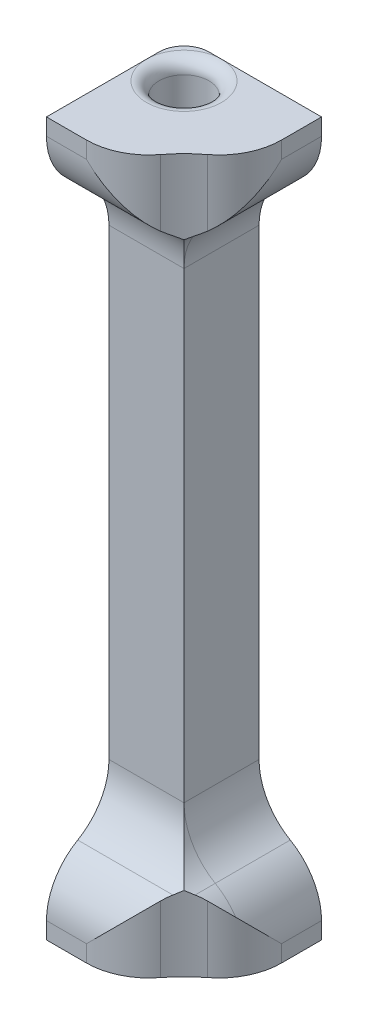
from build123d import *

# Parameters (mm, degrees)
BOSS_EXTRUDE1_DEPTH = 28.5
SKETCH3_R           = 2
CUT_EXTRUDE1_DEPTH  = 29.81405906844782
SKETCH4_W           = 5.000000000000001
SKETCH4_H           = 6
SKETCH4_W_2         = 6
SKETCH4_H_2         = 5
BOSS_EXTRUDE2_DEPTH = 5
FILLET1_R           = 10
FILLET3_R           = 5
FILLET4_R           = 5
FILLET5_R           = 2
CUT_EXTRUDE2_START  = -4
SKETCH5_R           = 2.5
CUT_EXTRUDE2_DEPTH  = 4
CUT_EXTRUDE3_START  = -8
SKETCH6_R           = 2.5
CUT_EXTRUDE3_DEPTH  = 4
FILLET6_R           = 1


# Some blends are built 0.0001 mm under size
with BuildPart() as part:
    # Sketch2 → Boss-Extrude1 (new body)
    with BuildSketch(Plane(origin=(0, 0, 0), x_dir=(1, 0, 0), z_dir=(0, 1, 0))):
        Polygon((-3.000000000000001, 3), (2.999999999999999, 3), (3, -3), (-3, -3), align=None)
    extrude(amount=BOSS_EXTRUDE1_DEPTH)

    # Sketch3 → Cut-Extrude1 (cut, through all)
    with BuildSketch(Plane.XZ):
        with Locations(Location((0, 0, 0), (0, 0, 270))):
            Circle(SKETCH3_R)
    extrude(amount=-CUT_EXTRUDE1_DEPTH, mode=Mode.SUBTRACT)

    # Sketch4 → Boss-Extrude2 (add)
    with BuildSketch(Plane.XZ):
        with Locations((5.5, 0)):
            Rectangle(SKETCH4_W, SKETCH4_H)
        with Locations((0, 5.5)):
            Rectangle(SKETCH4_W_2, SKETCH4_H_2)
    extrude(amount=-BOSS_EXTRUDE2_DEPTH)

    # Fillet1
    # the kernel refuses this fillet: 10 mm, written as the material it adds along each edge
    with BuildSketch(Plane(origin=(3, 0, 3), x_dir=(3.6e-16, 0, 1), z_dir=(0, 1, 0))) as fillet1_piece_1:
        with BuildLine():
            CenterArc((9.11437827766148, 9.114378277661475), FILLET1_R, 204.29518894536457, 41.4096221092708)
            Line((1.78e-15, 5), (0, 0))
            Line((0, 0), (5, 0))
        make_face()
    extrude(amount=5)

    # Fillet3
    # the kernel refuses this fillet: 5 mm, written as the material it adds along each edge
    with BuildSketch(Plane(origin=(3, 5, 3), x_dir=(0, 0, 1), z_dir=(-1, 0, 0))) as fillet3_piece_1:
        with BuildLine():
            CenterArc((FILLET3_R, FILLET3_R), FILLET3_R, 180, 90)
            Line((-8.9e-16, FILLET3_R), (0, 0))
            Line((0, 0), (FILLET3_R, 0))
        make_face()
    extrude(amount=6)
    with BuildSketch(Plane(origin=(2.999999999999999, 5, 3), x_dir=(1, 0, 0), z_dir=(0, 0, -1))) as fillet3_piece_2:
        with BuildLine():
            CenterArc((FILLET3_R, -FILLET3_R), FILLET3_R, 90, 90)
            Line((-8.9e-16, -FILLET3_R), (0, 0))
            Line((0, 0), (FILLET3_R, 0))
        make_face()
    extrude(amount=6)
    with BuildSketch(Plane(origin=(15.5, 5, 3), x_dir=(0, 0, 1), z_dir=(-1, 0, 0))) as fillet3_piece_3a_section:
        with BuildLine():
            CenterArc((FILLET3_R, FILLET3_R), FILLET3_R, 180, 90)
            Line((-8.9e-16, FILLET3_R), (0, 0))
            Line((0, 0), (FILLET3_R, 0))
        make_face()
    fillet3_piece_3a = extrude(amount=18.5, mode=Mode.PRIVATE)
    fillet3_piece_3a = fillet3_piece_3a - Plane(origin=(12.114378277661, 5, 12.114378277661), x_dir=(0, 0, 1), z_dir=(0, -1, 0)) * Cylinder(10, 57, mode=Mode.PRIVATE)
    fillet3_piece_3a = split(fillet3_piece_3a, bisect_by=Plane(origin=(8, 5, 3), z_dir=(-1, 0, 0)), keep=Keep.TOP, mode=Mode.PRIVATE)
    fillet3_piece_3a = split(fillet3_piece_3a, bisect_by=Plane(origin=(3, 5, 3.0000000000000018), z_dir=(1, 0, -1.5e-16)), keep=Keep.TOP, mode=Mode.PRIVATE)
    with BuildSketch(Plane(origin=(2.999999999999999, 5, 15.5), x_dir=(1, 0, 0), z_dir=(0, 0, -1))) as fillet3_piece_3b_section:
        with BuildLine():
            CenterArc((FILLET3_R, -FILLET3_R), FILLET3_R, 90, 90)
            Line((-8.9e-16, -FILLET3_R), (0, 0))
            Line((0, 0), (FILLET3_R, 0))
        make_face()
    fillet3_piece_3b = extrude(amount=18.5, mode=Mode.PRIVATE)
    fillet3_piece_3b = fillet3_piece_3b - Plane(origin=(12.114378277661, 5, 12.114378277661), x_dir=(0, 0, 1), z_dir=(0, -1, 0)) * Cylinder(10, 57, mode=Mode.PRIVATE)
    fillet3_piece_3b = split(fillet3_piece_3b, bisect_by=Plane(origin=(2.999999999999999, 5, 8), z_dir=(0, 0, -1)), keep=Keep.TOP, mode=Mode.PRIVATE)
    fillet3_piece_3b = split(fillet3_piece_3b, bisect_by=Plane(origin=(2.999999999999999, 5, 3), z_dir=(0, 0, 1)), keep=Keep.TOP, mode=Mode.PRIVATE)
    fillet3_piece_3 = fillet3_piece_3a & fillet3_piece_3b
    add(fillet3_piece_3)

    # Fillet4
    fillet4_edges = [part.edges().sort_by_distance(p)[0] for p in [
        (8, 2.5, 3),
        (8, 5, 0),
        (3, 2.5, 8),
        (0, 5, 8),
    ]]
    fillet(fillet4_edges, radius=FILLET4_R)

    # Mirror1: part across plane


with BuildPart() as part_1:
    add(part.part)
    add(part.part.mirror(Plane.ZX.offset(28.5)))

    # Fillet5
    fillet5_edges = [part_1.edges().sort_by_distance(p)[0] for p in [
        (-3.000000000000001, 28.5, -3),
    ]]
    fillet(fillet5_edges, radius=FILLET5_R)

    # Sketch5 → Cut-Extrude2 (cut)
    with BuildSketch(Plane.XZ.offset(CUT_EXTRUDE2_START)):
        with Locations(Location((0, 0, 0), (0, 0, 270))):
            Circle(SKETCH5_R)
    extrude(amount=-CUT_EXTRUDE2_DEPTH, mode=Mode.SUBTRACT)

    # Sketch6 → Cut-Extrude3 (cut)
    with BuildSketch(Plane(origin=(0, 57, 0), x_dir=(1, 0, 0), z_dir=(0, 1, 0)).offset(CUT_EXTRUDE3_START)):
        with Locations(Location((0, 0, 0), (0, 0, 90))):
            Circle(SKETCH6_R)
    extrude(amount=CUT_EXTRUDE3_DEPTH, mode=Mode.SUBTRACT)

    # Fillet6
    fillet6_edges = [part_1.edges().sort_by_distance(p)[0] for p in [
        (6.1e-16, 57, 2),
        (6.1e-16, 0, 2),
    ]]
    fillet(fillet6_edges, radius=FILLET6_R - 0.0001)  # a hair under: the kernel refuses the full size


solid = part_1.part
